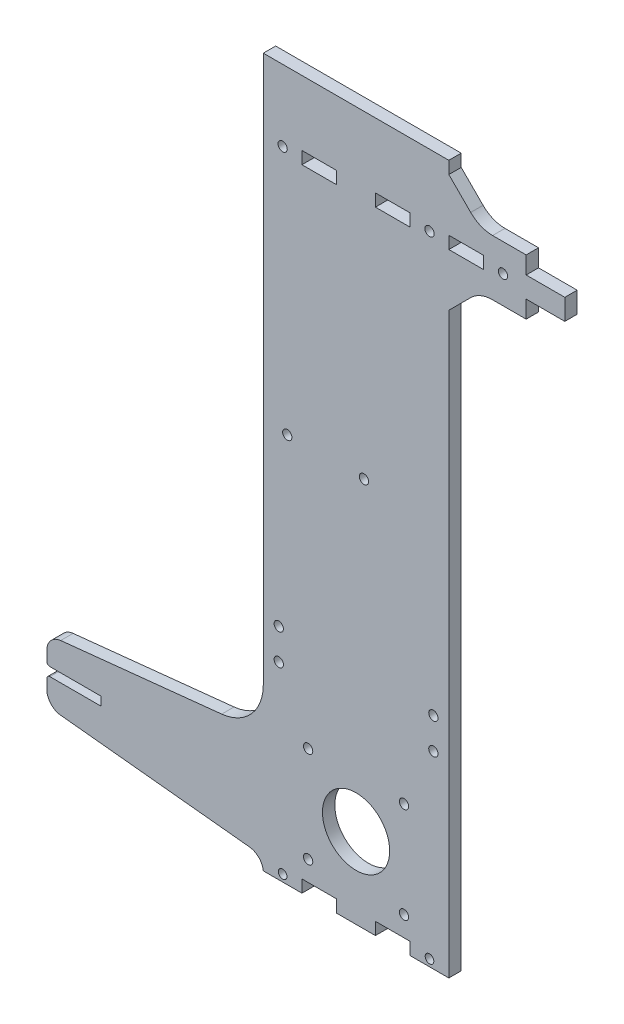
from build123d import *

# Parameters (mm, degrees)
SKETCH_1_R          = 1.5
SKETCH_1_R_2        = 10.875
EXTRUDE_1_DEPTH     = 4
FILLET_3_R          = 15
FILLET_4_R          = 5
FILLET_5_R          = 1
SKETCH_2_W          = 12.5
SKETCH_2_H          = 4
SKETCH_2_R          = 1.4
EXTRUDE_2_DEPTH     = 4
FILLET_6_R          = 5
SKETCH_4_R          = 1.5
SKETCH_4_W          = 11.25
SKETCH_4_H          = 4
CUT_EXTRUDE_2_DEPTH = 227.329405955
CHAMFER_1_SIZE      = 10
FILLET_7_R          = 10
SKETCH_3_R          = 1.5
CUT_EXTRUDE_1_DEPTH = 227.329405955


with BuildPart() as part:
    # Эскиз1 → Бобышка-Вытянуть1 (new body)
    with BuildSketch(Plane.XY):
        Polygon((-100, -14.71), (-30, -22), (30, -22), (30, 171), (55, 171), (55, 176.625), (67.5, 176.625), (67.5, 183.375), (55, 183.375), (55, 189), (30, 189), (30, 203), (-30, 203), (-30, 12.58), (-100, 5.29), (-100, -3.31), (-82.5, -3.31), (-82.5, -6.11), (-100, -6.11), align=None)
        with Locations((-15.5, -15.5)):
            Circle(SKETCH_1_R, mode=Mode.SUBTRACT)
        Circle(SKETCH_1_R_2, mode=Mode.SUBTRACT)
        with Locations((15.5, -15.5)):
            Circle(SKETCH_1_R, mode=Mode.SUBTRACT)
        with Locations((-15.5, 15.5)):
            Circle(SKETCH_1_R, mode=Mode.SUBTRACT)
        with Locations((15.5, 15.5)):
            Circle(SKETCH_1_R, mode=Mode.SUBTRACT)
        with Locations((-22.25, 100)):
            Circle(SKETCH_1_R, mode=Mode.SUBTRACT)
        with Locations((2.55, 100)):
            Circle(SKETCH_1_R, mode=Mode.SUBTRACT)
    extrude(amount=EXTRUDE_1_DEPTH)

    # Скругление3
    fillet_3_edges = [part.edges().sort_by_distance(p)[0] for p in [
        (-30, 12.58, 2),
    ]]
    fillet(fillet_3_edges, radius=FILLET_3_R)

    # Скругление4
    fillet_4_edges = [part.edges().sort_by_distance(p)[0] for p in [
        (-100, -14.71, 2),
        (-100, 5.29, 2),
    ]]
    fillet(fillet_4_edges, radius=FILLET_4_R)

    # Скругление5
    fillet_5_edges = [part.edges().sort_by_distance(p)[0] for p in [
        (-100, -6.11, 2),
        (-100, -3.31, 2),
    ]]
    fillet(fillet_5_edges, radius=FILLET_5_R)

    # Эскиз2 → Бобышка-Вытянуть2 (add, through all)
    # profile 1 of 3: a face of its own
    with BuildSketch(Plane.XY.offset(4)):
        with Locations((-23.75, -24)):
            Rectangle(SKETCH_2_W, SKETCH_2_H)
        with Locations((-23.75, -23.75)):
            Circle(SKETCH_2_R, mode=Mode.SUBTRACT)
    # profile 2 of 3: a face of its own
    with BuildSketch(Plane.XY.offset(4)):
        with Locations((0, -24)):
            Rectangle(SKETCH_2_W, SKETCH_2_H)
    # profile 3 of 3: a face of its own
    with BuildSketch(Plane.XY.offset(4)):
        with Locations((23.75, -24)):
            Rectangle(SKETCH_2_W, SKETCH_2_H)
        with Locations((23.75, -23.75)):
            Circle(SKETCH_2_R, mode=Mode.SUBTRACT)
    extrude(amount=-EXTRUDE_2_DEPTH)

    # Скругление6
    # the kernel refuses this fillet: 5 mm, written as the material it adds along each edge
    with BuildSketch(Plane(origin=(-30, -22, 0), x_dir=(0, -1, 0), z_dir=(0, 0, 1))) as fillet_6_piece_1:
        with BuildLine():
            CenterArc((4.509032444, -4.974021107), FILLET_6_R, 95.843205651, 78.21128084)
            Line((-0.4640718, -4.456107822), (-0.563533885, -4.445749556))
            Line((-0.563533885, -4.445749556), (-0.099462085, 0.010358266))
            Line((-0.099462085, 0.010358266), (0, 0.1))
            ThreePointArc((0, 0.1), (2, 0.1), (3.989819351, 0.099480422))
            Line((3.989819351, 0.099480422), (4, 0))
        make_face()
    extrude(amount=4)

    # Эскиз4 → Вырез-Вытянуть2 (cut, through all)
    with BuildSketch(Plane.XY.offset(4)):
        with Locations((23.75, 180)):
            Circle(SKETCH_4_R)
        with Locations((-23.75, 180)):
            Circle(SKETCH_4_R)
        with Locations((-11.875, 180)):
            Rectangle(SKETCH_4_W, SKETCH_4_H)
        with Locations((11.875, 180)):
            Rectangle(SKETCH_4_W, SKETCH_4_H)
        with Locations((35.625, 180)):
            Rectangle(SKETCH_4_W, SKETCH_4_H)
        with Locations((47.5, 180)):
            Circle(SKETCH_4_R)
    extrude(amount=-CUT_EXTRUDE_2_DEPTH, mode=Mode.SUBTRACT)

    # Фаска1
    chamfer_1_edges = [part.edges().sort_by_distance(p)[0] for p in [
        (30, 171, 2),
        (30, 189, 2),
    ]]
    chamfer(chamfer_1_edges, length=CHAMFER_1_SIZE)

    # Скругление7
    fillet_7_edges = [part.edges().sort_by_distance(p)[0] for p in [
        (40, 171, 2),
        (40, 189, 2),
    ]]
    fillet(fillet_7_edges, radius=FILLET_7_R)

    # Эскиз3 → Вырез-Вытянуть1 (cut, through all)
    with BuildSketch(Plane.XY.offset(4)):
        with Locations((-25, 45)):
            Circle(SKETCH_3_R)
        with Locations((25, 45)):
            Circle(SKETCH_3_R)
        with Locations((-25, 35)):
            Circle(SKETCH_3_R)
        with Locations((25, 35)):
            Circle(SKETCH_3_R)
    extrude(amount=-CUT_EXTRUDE_1_DEPTH, mode=Mode.SUBTRACT)


solid = part.part
